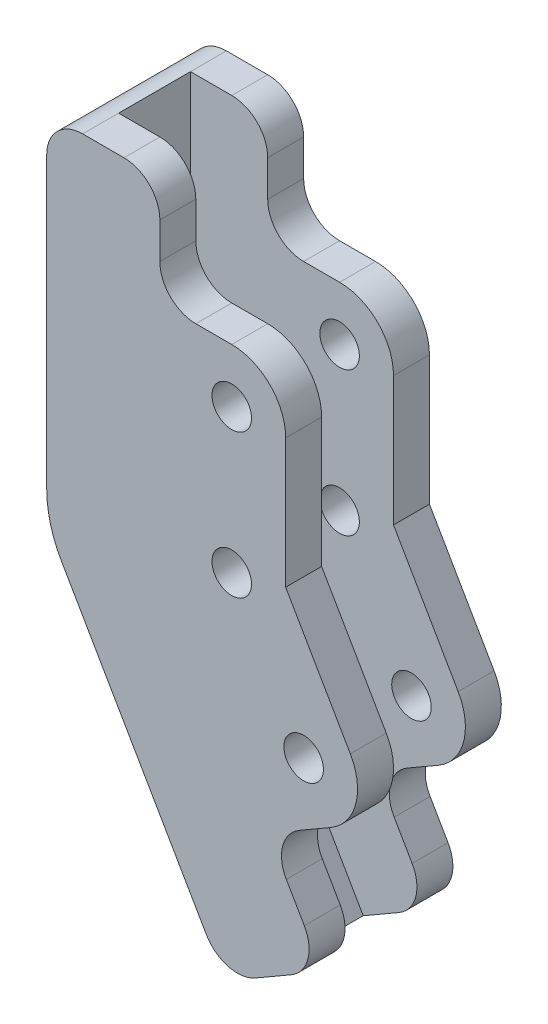
from build123d import *

# Parameters (mm, degrees)
SKETCH1_R           = 2.75
BOSS_EXTRUDE1_DEPTH = 5
SKETCH2_R           = 2.75
BOSS_EXTRUDE2_DEPTH = 5
BOSS_EXTRUDE3_START = -20
BOSS_EXTRUDE3_DEPTH = 20
FILLET1_R           = 5


with BuildPart() as part:
    # Sketch1 → Boss-Extrude1 (new body)
    with BuildSketch(Plane.XY):
        with BuildLine():
            ThreePointArc((7.840741737, 145.091301473), (5.644042596, 150.394602332), (0.340741737, 152.591301473))
            Line((0.340741737, 152.591301473), (-9.659258263, 152.591301473))
            Line((-9.659258263, 152.591301473), (-9.659258263, 167.591301473))
            Line((-9.659258263, 167.591301473), (-20.400000003, 167.591301473))
            Line((-20.400000003, 167.591301473), (-20.4, 122.320508076))
            ThreePointArc((-20.4, 122.320508076), (-20.045628593, 119.628790007), (-19.006664199, 117.120508076))
            Line((-19.006664199, 117.120508076), (3.628732497, 77.914850942))
            Line((3.628732497, 77.914850942), (12.930487699, 83.285221812))
            Line((12.930487699, 83.285221812), (5.430487699, 96.275602869))
            Line((5.430487699, 96.275602869), (14.090741737, 101.275602869))
            ThreePointArc((14.090741737, 101.275602869), (17.585185434, 105.829650559), (16.835932265, 111.520793398))
            Line((16.835932265, 111.520793398), (7.840741737, 127.100920417))
            Line((7.840741737, 127.100920417), (7.840741737, 145.091301473))
        make_face()
        with Locations((10.340741737, 107.770793398)):
            Circle(SKETCH1_R, mode=Mode.SUBTRACT)
        with Locations((0.340741737, 125.091301473)):
            Circle(SKETCH1_R, mode=Mode.SUBTRACT)
        with Locations((0.340741737, 145.091301473)):
            Circle(SKETCH1_R, mode=Mode.SUBTRACT)
    extrude(amount=BOSS_EXTRUDE1_DEPTH)



with BuildPart() as body_2:
    # Sketch2 → Boss-Extrude2 (new body)
    with BuildSketch(Plane(origin=(0, 0, -10), x_dir=(-1, 0, 0), z_dir=(0, 0, -1))):
        with BuildLine():
            Line((-14.090741737, 101.275602869), (-5.430487699, 96.275602869))
            Line((-5.430487699, 96.275602869), (-12.930487699, 83.285221812))
            Line((-12.930487699, 83.285221812), (-3.628732497, 77.914850942))
            Line((-3.628732497, 77.914850942), (19.006664199, 117.120508076))
            ThreePointArc((19.006664199, 117.120508076), (20.045628593, 119.628790007), (20.4, 122.320508076))
            Line((20.4, 122.320508076), (20.400000003, 167.591301473))
            Line((20.400000003, 167.591301473), (9.659258263, 167.591301473))
            Line((9.659258263, 167.591301473), (9.659258263, 152.591301473))
            Line((9.659258263, 152.591301473), (-0.340741737, 152.591301473))
            ThreePointArc((-0.340741737, 152.591301473), (-5.644042596, 150.394602332), (-7.840741737, 145.091301473))
            Line((-7.840741737, 145.091301473), (-7.840741737, 127.100920417))
            Line((-7.840741737, 127.100920417), (-16.835932265, 111.520793398))
            ThreePointArc((-16.835932265, 111.520793398), (-17.585185434, 105.829650559), (-14.090741737, 101.275602869))
        make_face()
        with Locations(Location((-10.340741737, 107.770793398, 0), (0, 0, 180))):
            Circle(SKETCH2_R, mode=Mode.SUBTRACT)
        with Locations(Location((-0.340741737, 125.091301473, 0), (0, 0, 180))):
            Circle(SKETCH2_R, mode=Mode.SUBTRACT)
        with Locations(Location((-0.340741737, 145.091301473, 0), (0, 0, 180))):
            Circle(SKETCH2_R, mode=Mode.SUBTRACT)
    extrude(amount=BOSS_EXTRUDE2_DEPTH)


with BuildPart() as part_1:
    add(part.part)

    add(body_2.part)  # Boss-Extrude3 merges body 2
    # Sketch3 → Boss-Extrude3 (add)
    with BuildSketch(Plane.XY.offset(5).offset(BOSS_EXTRUDE3_START)):
        with BuildLine():
            Line((-0.701394522, 75.414850943), (3.628732497, 77.914850942))
            Line((3.628732497, 77.914850942), (-19.006664199, 117.120508076))
            ThreePointArc((-19.006664199, 117.120508076), (-20.045628593, 119.628790007), (-20.4, 122.320508076))
            Line((-20.4, 122.320508076), (-20.400000003, 167.591301473))
            Line((-20.400000003, 167.591301473), (-25.400000003, 167.591301473))
            Line((-25.400000003, 167.591301473), (-25.4, 122.320508076))
            ThreePointArc((-25.4, 122.320508076), (-24.875257725, 118.334694781), (-23.336791218, 114.620508076))
            Line((-23.336791218, 114.620508076), (-0.701394522, 75.414850943))
        make_face()
    extrude(amount=BOSS_EXTRUDE3_DEPTH)

    # Fillet1
    fillet1_edges = [part_1.edges().sort_by_distance(p)[0] for p in [
        (5.430487699, 96.275602869, 2.5),
        (12.930487699, 83.285221812, 2.5),
        (-9.659258263, 167.591301473, 2.5),
        (-9.659258263, 152.591301473, 2.5),
        (-0.701394522, 75.414850943, -5),
        (-25.400000003, 167.591301473, -5),
        (5.430487699, 96.275602869, -12.5),
        (12.930487699, 83.285221812, -12.5),
        (-9.659258263, 167.591301473, -12.5),
        (-9.659258263, 152.591301473, -12.5),
    ]]
    fillet(fillet1_edges, radius=FILLET1_R - 0.0001)  # a hair under: the kernel refuses the full size


solid = part_1.part
